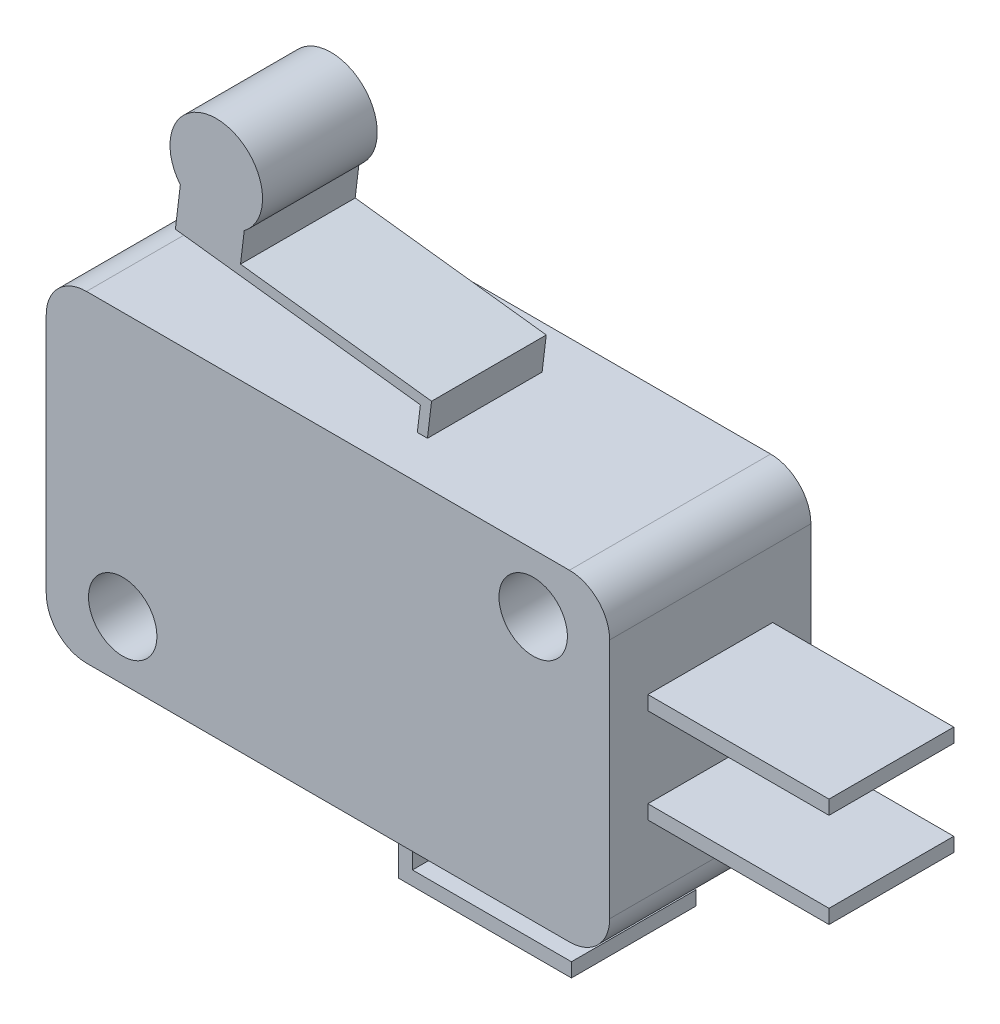
from build123d import *

# Parameters (mm, degrees)
SKETCH1_R           = 1.7
BOSS_EXTRUDE1_DEPTH = 5
BOSS_EXTRUDE2_DEPTH = 2.85
SKETCH3_W           = 9
SKETCH3_H           = 0.7
BOSS_EXTRUDE3_DEPTH = 3.1


with BuildPart() as part:
    # Sketch1 → Boss-Extrude1 (new, symmetric)
    with BuildSketch(Plane.XY):
        with BuildLine():
            Line((2, 0), (26, 0))
            ThreePointArc((26, 0), (27.414213562, 0.585786438), (28, 2))
            Line((28, 2), (28, 14))
            ThreePointArc((28, 14), (27.414213562, 15.414213562), (26, 16))
            Line((26, 16), (2, 16))
            ThreePointArc((2, 16), (0.585786438, 15.414213562), (0, 14))
            Line((0, 14), (0, 2))
            ThreePointArc((0, 2), (0.585786438, 0.585786438), (2, 0))
        make_face()
        with Locations((3.8, 2.9)):
            Circle(SKETCH1_R, mode=Mode.SUBTRACT)
        with Locations((24.2, 13.1)):
            Circle(SKETCH1_R, mode=Mode.SUBTRACT)
    extrude(amount=BOSS_EXTRUDE1_DEPTH, both=True)

    # Sketch2 → Boss-Extrude2 (add, symmetric)
    with BuildSketch(Plane.XY):
        with BuildLine():
            Line((16.443613757, 17.263612158), (15.919001734, 12.923377494))
            Line((15.919001734, 12.923377494), (16.415388776, 12.863378293))
            Line((16.415388776, 12.863378293), (17, 17.7))
            Line((17, 17.7), (7.504443651, 18.847745091))
            Line((7.504443651, 18.847745091), (7.690168637, 20.384290169))
            ThreePointArc((7.690168637, 20.384290169), (6.575996323, 24.5), (4.513291566, 20.768285054))
            Line((4.513291566, 20.768285054), (4.267567379, 18.735352933))
            Line((4.267567379, 18.735352933), (16.443613757, 17.263612158))
        make_face()
    extrude(amount=BOSS_EXTRUDE2_DEPTH, both=True)

    # Sketch3 → Boss-Extrude3 (add, symmetric)
    with BuildSketch(Plane.XY):
        with Locations((32.5, 10.35)):
            Rectangle(SKETCH3_W, SKETCH3_H)
        with Locations((32.5, 5.65)):
            Rectangle(SKETCH3_W, SKETCH3_H)
        Polygon((15.6, 0), (15.6, -3.4), (24.2, -3.4), (24.2, -2.7), (16.3, -2.7), (16.3, 0), align=None)
    extrude(amount=BOSS_EXTRUDE3_DEPTH, both=True)


solid = part.part
